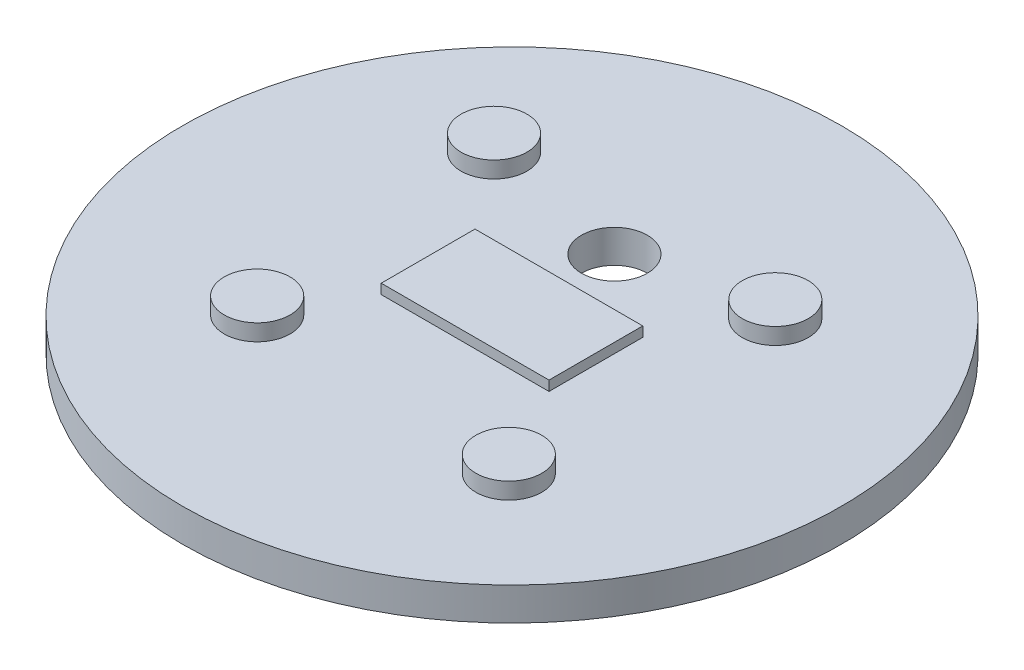
from build123d import *

# Parameters (mm, degrees)
SKETCH_1_R          = 100
EXTRUDE_1_DEPTH     = 10
SKETCH_3_W          = 50.90867769
SKETCH_3_H          = 28.448966944
EXTRUDE_2_DEPTH     = 3
SKETCH_4_R          = 10
CUT_EXTRUDE_1_DEPTH = 13
SKETCH_5_R          = 10
EXTRUDE_3_DEPTH     = 5


with BuildPart() as part:
    # 草图1 → 凸台-拉伸1 (new body)
    with BuildSketch(Plane(origin=(0, 0, 0), x_dir=(1, 0, 0), z_dir=(0, 1, 0))):
        Circle(SKETCH_1_R)
    extrude(amount=-EXTRUDE_1_DEPTH)

    # 草图3 → 凸台-拉伸2 (add)
    with BuildSketch(Plane(origin=(0, 0, 0), x_dir=(1, 0, 0), z_dir=(0, 1, 0))):
        Rectangle(SKETCH_3_W, SKETCH_3_H)
    extrude(amount=EXTRUDE_2_DEPTH)

    # 草图4 → 切除-拉伸1 (cut)
    with BuildSketch(Plane(origin=(0, 0, 0), x_dir=(1, 0, 0), z_dir=(0, 1, 0))):
        with Locations((-0.694974251, 31.764448054)):
            Circle(SKETCH_4_R)
    extrude(amount=-CUT_EXTRUDE_1_DEPTH, mode=Mode.SUBTRACT)

    # 草图5 → 凸台-拉伸3 (add)
    with BuildSketch(Plane(origin=(0, 0, 0), x_dir=(1, 0, 0), z_dir=(0, 1, 0))):
        with Locations((40.855283356, -41.817842388)):
            Circle(SKETCH_5_R)
        with Locations((-38.930165292, -38.395410274)):
            Circle(SKETCH_5_R)
        with Locations((-45.775029519, 40.320528338)):
            Circle(SKETCH_5_R)
        with Locations((40.641381349, 39.251018302)):
            Circle(SKETCH_5_R)
    extrude(amount=EXTRUDE_3_DEPTH)


solid = part.part
